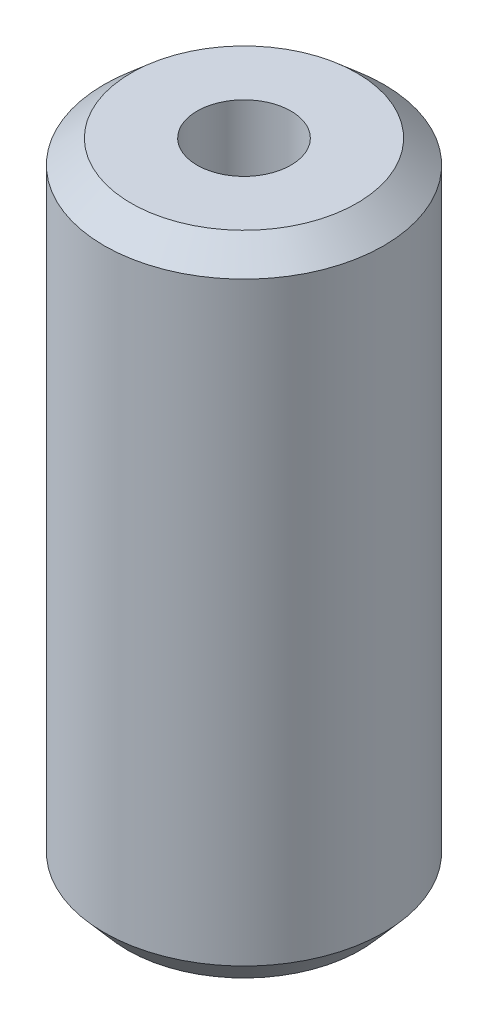
from build123d import *
from OCP.BRepFilletAPI import BRepFilletAPI_MakeChamfer

# Parameters (mm, degrees)
SKETCH1_R           = 22.5
BOSS_EXTRUDE1_DEPTH = 103.860640126
SKETCH2_R           = 7.557692724
CUT_EXTRUDE1_DEPTH  = 109.625653358
CHAMFER1_SIZE       = 3.759095197
CHAMFER1_SIZE2      = 4.323511525


with BuildPart() as part:
    # Sketch1 → Boss-Extrude1 (new body)
    with BuildSketch(Plane(origin=(0, 0, 0), x_dir=(1, 0, 0), z_dir=(0, 1, 0))):
        Circle(SKETCH1_R)
    extrude(amount=BOSS_EXTRUDE1_DEPTH)

    # Sketch2 → Cut-Extrude1 (cut, through all)
    with BuildSketch(Plane(origin=(0, 0, 0), x_dir=(1, 0, 0), z_dir=(0, 1, 0))):
        Circle(SKETCH2_R)
    extrude(amount=CUT_EXTRUDE1_DEPTH, mode=Mode.SUBTRACT)

    # Chamfer1: one chamfer whose edges measure the first distance from different faces: ONE call of the kernel's chamfer builder (chamfer() names one face for all edges)
    chamfer1_edges_1 = [part.edges().sort_by_distance(p)[0] for p in [
        (-22.5, 103.860640126, 0),
    ]]
    chamfer1_side_1 = [part.faces().sort_by_distance(p)[0] for p in [
        (-22.5, 51.930320063, 0),
    ]]
    chamfer1_edges_2 = [part.edges().sort_by_distance(p)[0] for p in [
        (-22.5, 0, 0),
    ]]
    chamfer1_side_2 = [part.faces().sort_by_distance(p)[0] for p in [
        (-21.863603897, 0, 0),
    ]]
    chamfer1 = BRepFilletAPI_MakeChamfer(part.part.solid().wrapped)
    for e in chamfer1_edges_1:
        chamfer1.Add(CHAMFER1_SIZE, CHAMFER1_SIZE2, e.wrapped, chamfer1_side_1[0].wrapped)  # the first distance lies on this face
    for e in chamfer1_edges_2:
        chamfer1.Add(CHAMFER1_SIZE, CHAMFER1_SIZE2, e.wrapped, chamfer1_side_2[0].wrapped)  # the first distance lies on this face
    add(Compound.cast(chamfer1.Shape()), mode=Mode.REPLACE)


solid = part.part
